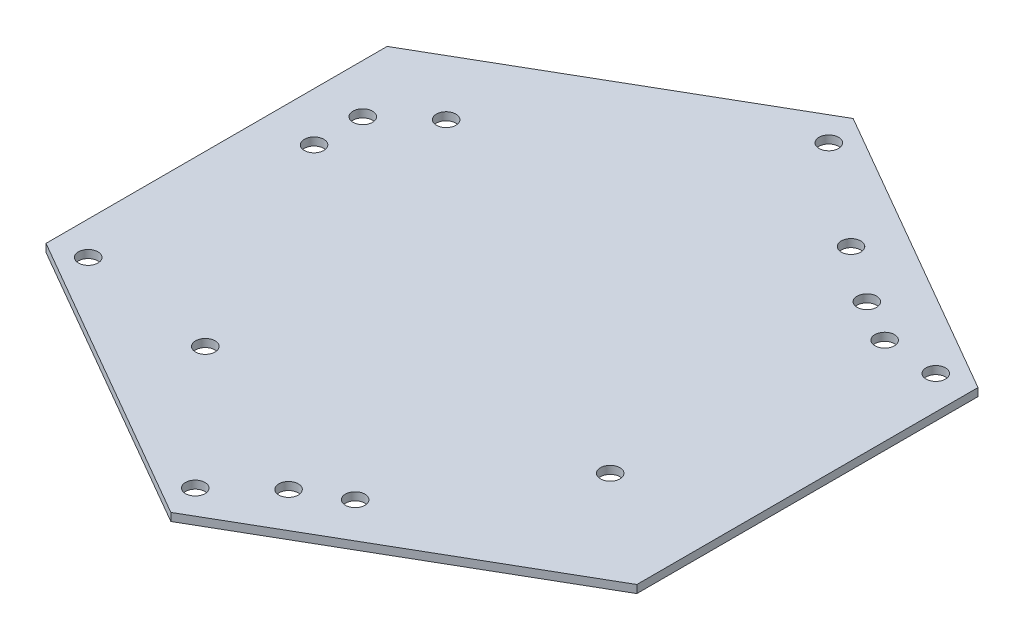
from build123d import *

# Parameters (mm, degrees)
SKETCH1_R           = 2.54
BOSS_EXTRUDE1_DEPTH = 2.0574
SKETCH2_R           = 2.54
CUT_EXTRUDE1_DEPTH  = 118.621640844
SKETCH3_R           = 2.54
CUT_EXTRUDE2_DEPTH  = 118.621640844


with BuildPart() as part:
    # Sketch1 → Boss-Extrude1 (new body)
    with BuildSketch(Plane(origin=(0, 0, 0), x_dir=(1, 0, 0), z_dir=(0, 1, 0))):
        Polygon((0, 88.9), (-76.989658396, 44.45), (-76.989658396, -44.45), (0, -88.9), (76.989658396, -44.45), (76.989658396, 44.45), align=None)
        with Locations((10.147783942, -68.376477372)):
            Circle(SKETCH1_R, mode=Mode.SUBTRACT)
        with Locations((21.14630657, -62.026477372)):
            Circle(SKETCH1_R, mode=Mode.SUBTRACT)
        with Locations((-64.289658396, 25.4)):
            Circle(SKETCH1_R, mode=Mode.SUBTRACT)
        with Locations((-64.289658396, 12.7)):
            Circle(SKETCH1_R, mode=Mode.SUBTRACT)
        with Locations((54.141874454, 42.976477372)):
            Circle(SKETCH1_R, mode=Mode.SUBTRACT)
        with Locations((43.143351826, 49.326477372)):
            Circle(SKETCH1_R, mode=Mode.SUBTRACT)
    extrude(amount=BOSS_EXTRUDE1_DEPTH)

    # Sketch2 → Cut-Extrude1 (cut, through all)
    with BuildSketch(Plane(origin=(0, 2.0574, 0), x_dir=(1, 0, 0), z_dir=(0, 1, 0))):
        with Locations((28.620590949, 59.732317666)):
            Circle(SKETCH2_R)
        with Locations((48.416295038, -22.82051708)):
            Circle(SKETCH2_R)
        with Locations((-52.77011314, 35.59948292)):
            Circle(SKETCH2_R)
        with Locations((-32.974409051, -46.953351826)):
            Circle(SKETCH2_R)
    extrude(amount=-CUT_EXTRUDE1_DEPTH, mode=Mode.SUBTRACT)

    # Sketch3 → Cut-Extrude2 (cut, through all)
    with BuildSketch(Plane(origin=(0, 2.0574, 0), x_dir=(1, 0, 0), z_dir=(0, 1, 0))):
        with Locations((-68.315397082, -42.125738686)):
            Circle(SKETCH3_R)
        with Locations((-2.324261314, -80.225738686)):
            Circle(SKETCH3_R)
        with Locations((2.324261314, 80.225738686)):
            Circle(SKETCH3_R)
        with Locations((68.315397082, 42.125738686)):
            Circle(SKETCH3_R)
    extrude(amount=-CUT_EXTRUDE2_DEPTH, mode=Mode.SUBTRACT)


solid = part.part
